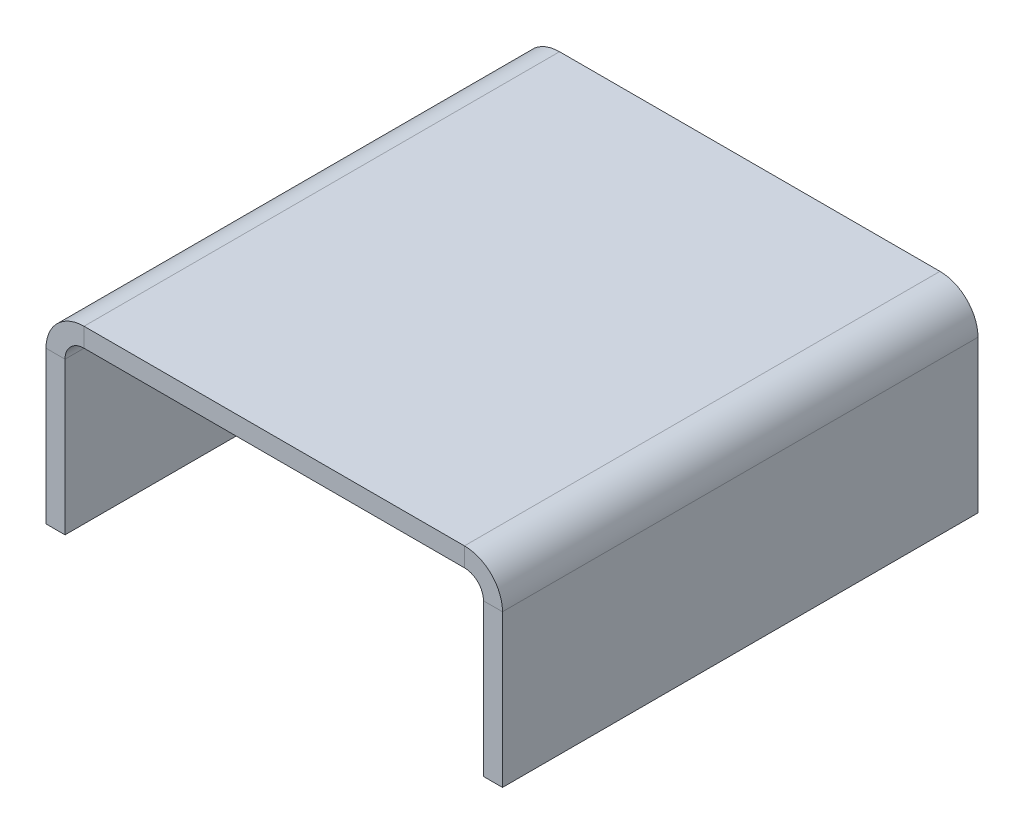
from build123d import *

# Parameters (mm, degrees)
SM_BASE_FLANGE_1_DEPTH = 50


# Sheet-metal steps are written as plain solids
with BuildPart() as part:
    # Sketch 1 → Базовая кромка1 (new body)
    with BuildSketch(Plane.XY):
        with BuildLine():
            Line((0, 0), (0, 16))
            ThreePointArc((0, 16), (1.171572875, 18.828427125), (4, 20))
            Line((4, 20), (44, 20))
            ThreePointArc((44, 20), (46.828427125, 18.828427125), (48, 16))
            Line((48, 16), (48, 0))
            Line((48, 0), (46, 0))
            Line((46, 0), (46, 16))
            ThreePointArc((46, 16), (45.414213562, 17.414213562), (44, 18))
            Line((44, 18), (4, 18))
            ThreePointArc((4, 18), (2.585786438, 17.414213562), (2, 16))
            Line((2, 16), (2, 0))
            Line((2, 0), (0, 0))
        make_face()
    extrude(amount=-SM_BASE_FLANGE_1_DEPTH)


solid = part.part
